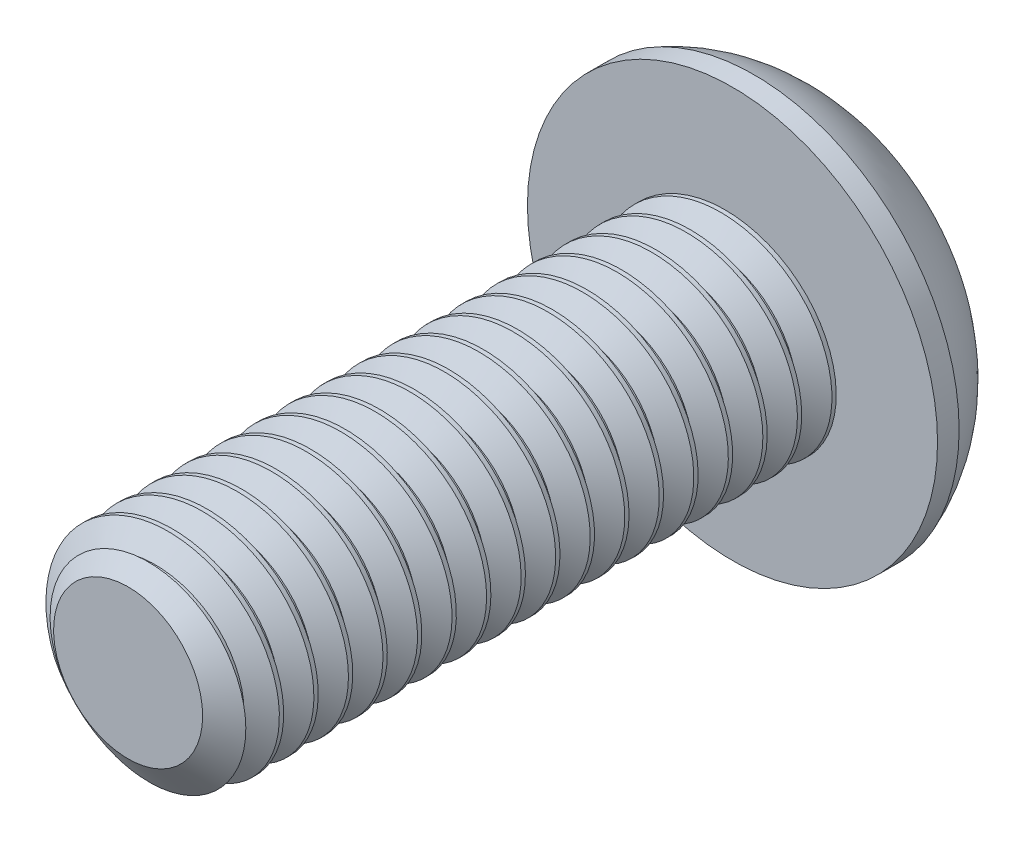
from build123d import *

# Parameters (mm, degrees)
SKETCH1_R          = 2.5
EXTRUDE1_DEPTH     = 14
CUT_SWEEP1_PITCH   = 0.7999999999999953
SKETCH6_R          = 4.75
EXTRUDE2_DEPTH     = 2.75
CUT_EXTRUDE1_DEPTH = 2.25
SKETCH8_R          = 1.7320508075688774
CUT_EXTRUDE2_DEPTH = 19.046814268728983
CUT_EXTRUDE2_TAPER = 45.0000000000001


with BuildPart() as part:
    # Sketch1 → Extrude1 (new body)
    with BuildSketch(Plane.XY):
        Circle(SKETCH1_R)
    extrude(amount=-EXTRUDE1_DEPTH)

    # Cut-Sweep1: the profile of Sketch3 profile screwed along a right-hand helix of 18.5 turns, 6 arcs to a turn; built about Z, then put on its axis
    cut_sweep1_z = Axis((0, 0, 0), (0, 0, 1))
    cut_sweep1_corners = [(2.5003, 0, -0.700173205), (1.980384758, 0, -0.4), (1.980384758, 0, -0.3), (2.5003, 0, 0.000173205)]
    with BuildLine(mode=Mode.PRIVATE) as cut_sweep1_profile:
        Line(cut_sweep1_corners[0], cut_sweep1_corners[1])
        Line(cut_sweep1_corners[1], cut_sweep1_corners[2])
        Line(cut_sweep1_corners[2], cut_sweep1_corners[3])
        Line(cut_sweep1_corners[3], cut_sweep1_corners[0])
    cut_sweep1_cap = Face(cut_sweep1_profile.wire())
    cut_sweep1_turn_angles = [0, 30, 60, 90, 120, 150, 180, 210, 240, 270, 300, 330, 360]
    cut_sweep1_turn_weights = [1, 0.8660254037844387, 1, 0.8660254037844387, 1, 0.8660254037844387, 1, 0.8660254037844387, 1, 0.8660254037844387, 1, 0.8660254037844387, 1]
    cut_sweep1_turn_rails = [Edge.make_bspline([Vector(p[0], p[1], 0).rotate(cut_sweep1_z, cut_sweep1_turn_angles[k]) / cut_sweep1_turn_weights[k] + Vector(0, 0, p[2] + CUT_SWEEP1_PITCH * cut_sweep1_turn_angles[k] / 360) for k in range(13)], [0, 0, 0, 1, 1, 2, 2, 3, 3, 4, 4, 5, 5, 6, 6, 6], 2, cut_sweep1_turn_weights) for p in cut_sweep1_corners]
    cut_sweep1_turn_sides = [Face.make_surface_from_curves(cut_sweep1_turn_rails[p[0]], cut_sweep1_turn_rails[p[1]]) for p in [(0, 1), (1, 2), (2, 3), (3, 0)]]
    cut_sweep1_last_angles = [6480, 6510, 6540, 6570, 6600, 6630, 6660]
    cut_sweep1_last_weights = [1, 0.8660254037844387, 1, 0.8660254037844387, 1, 0.8660254037843871, 1]
    cut_sweep1_last_rails = [Edge.make_bspline([Vector(p[0], p[1], 0).rotate(cut_sweep1_z, cut_sweep1_last_angles[k]) / cut_sweep1_last_weights[k] + Vector(0, 0, p[2] + CUT_SWEEP1_PITCH * cut_sweep1_last_angles[k] / 360) for k in range(7)], [0, 0, 0, 1, 1, 2, 2, 3, 3, 3], 2, cut_sweep1_last_weights) for p in cut_sweep1_corners]
    cut_sweep1_last_sides = [Face.make_surface_from_curves(cut_sweep1_last_rails[p[0]], cut_sweep1_last_rails[p[1]]) for p in [(0, 1), (1, 2), (2, 3), (3, 0)]]
    cut_sweep1 = Plane(origin=(0, 0, 0), x_dir=(-3.49e-15, 1, 0), z_dir=(0, 0, -1)) * Solid(Shell([*[p.moved(Location((0, 0, CUT_SWEEP1_PITCH * i))) for i in range(18) for p in cut_sweep1_turn_sides], *cut_sweep1_last_sides, cut_sweep1_cap, cut_sweep1_cap.rotate(cut_sweep1_z, 6660).moved(Location((0, 0, CUT_SWEEP1_PITCH * 6660 / 360)))]))
    add(cut_sweep1, mode=Mode.SUBTRACT)

    # Sketch4 → Cut-Revolve1 (revolve, cut)
    with BuildSketch(Plane(origin=(0, 0, 0), x_dir=(0, 0, -1), z_dir=(1, 0, 0)), mode=Mode.PRIVATE) as cut_revolve1_sk:
        Polygon((0.5416912243118476, 2.5), (0, 1.7263847577293348), (0, 2.5), align=None)
    revolve(cut_revolve1_sk.sketch.rotate(Axis((0, 0, 0), (0, 0, -1)), 260.43858876), axis=Axis((0, 0, 0), (0, 0, -1)), mode=Mode.SUBTRACT)

    # Sketch6 → Extrude2 (add)
    with BuildSketch(Plane(origin=(0, 0, -14), x_dir=(-1, 0, 0), z_dir=(0, 0, -1))):
        Circle(SKETCH6_R)
    extrude(amount=EXTRUDE2_DEPTH)

    # Sketch10 → Cut-Revolve2 (revolve, cut)
    with BuildSketch(Plane(origin=(0, 0, 0), x_dir=(0, 0, -1), z_dir=(1, 0, 0)), mode=Mode.PRIVATE) as cut_revolve2_sk:
        with BuildLine():
            Line((14.5, 4.75), (14.499999999999998, 5.25))
            Line((14.499999999999998, 5.25), (17.25, 5.25))
            Line((17.25, 5.25), (17.25, 1.5000000000000004))
            Line((17.25, 1.5000000000000004), (16.75, 1.5000000000000004))
            ThreePointArc((16.75, 1.5000000000000004), (16.132611776540898, 3.4764235376052373), (14.5, 4.75))
        make_face()
    revolve(cut_revolve2_sk.sketch.rotate(Axis((0, 0, 0), (0, 0, -1)), 90), axis=Axis((0, 0, 0), (0, 0, -1)), mode=Mode.SUBTRACT)

    # Sketch7 → Cut-Extrude1 (cut)
    with BuildSketch(Plane(origin=(0, 0, -16.75), x_dir=(-1, 0, 0), z_dir=(0, 0, -1))):
        Polygon((-2.6e-16, 1.7320508075688774), (-1.5, 0.8660254037844389), (-1.5, -0.8660254037844387), (1e-16, -1.7320508075688774), (1.5000000000000009, -0.8660254037844387), (1.5000000000000002, 0.8660254037844387), align=None)
    extrude(amount=-CUT_EXTRUDE1_DEPTH, mode=Mode.SUBTRACT)

    # Sketch8 → Cut-Extrude2 (cut, through all)
    with BuildSketch(Plane.XY.offset(-16.75)):
        Circle(SKETCH8_R)
    extrude(amount=CUT_EXTRUDE2_DEPTH, taper=CUT_EXTRUDE2_TAPER, mode=Mode.SUBTRACT)


solid = part.part
